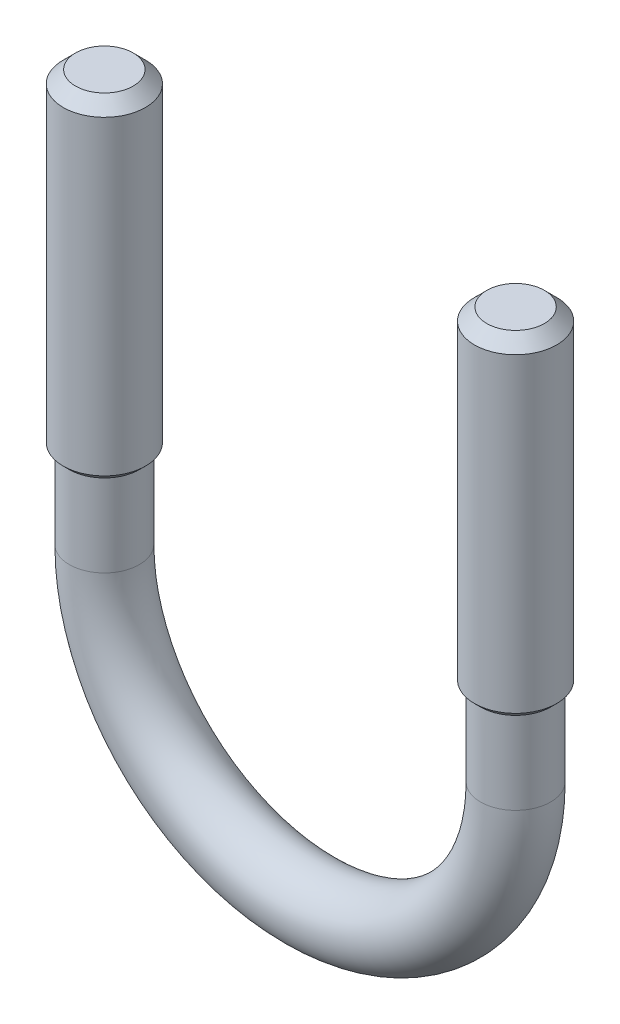
from build123d import *

# Parameters (mm, degrees)
SKETCH2_R           = 3.175
BOSS_EXTRUDE1_DEPTH = 25.4
CHAMFER2_SIZE       = 0.9525
CHAMFER3_SIZE       = 0.4699
SKETCH12_R          = 2.7051
SKETCH9_R           = 3.175
BOSS_EXTRUDE2_DEPTH = 2.778125
SKETCH10_OUTSIDE_W  = 233.937
SKETCH10_OUTSIDE_H  = 203.708
SKETCH10_OUTSIDE_R  = 5.55625
CUT_EXTRUDE1_DEPTH  = 51.205782884
CUT_EXTRUDE1_DRAFT  = -60
SKETCH11_OUTSIDE_W  = 217.071
SKETCH11_OUTSIDE_H  = 186.842
SKETCH11_OUTSIDE_R  = 5.55625
CUT_EXTRUDE2_DEPTH  = 46.336665415
CUT_EXTRUDE2_DRAFT  = -60
CHAMFER4_SIZE       = 0.381
LPATTERN1_COUNT     = 2
LPATTERN1_PITCH     = 31.75


with BuildPart() as part:
    # Sketch2 → Boss-Extrude1 (new body)
    with BuildSketch(Plane(origin=(0, 31.75, 0), x_dir=(-1, 0, 0), z_dir=(0, 1, 0))):
        with Locations(Location((15.875, 0, 0), (0, 0, 90))):
            Circle(SKETCH2_R)
    extrude(amount=-BOSS_EXTRUDE1_DEPTH)

    # Chamfer2
    chamfer2_edges = [part.edges().sort_by_distance(p)[0] for p in [
        (-15.875, 31.75, -3.175),
    ]]
    chamfer(chamfer2_edges, length=CHAMFER2_SIZE)

    # Chamfer3
    chamfer3_edges = [part.edges().sort_by_distance(p)[0] for p in [
        (-15.875, 6.35, -3.175),
    ]]
    chamfer(chamfer3_edges, length=CHAMFER3_SIZE)


with BuildPart() as body_2:
    # Mirror2: mirrored copy
    add(part.part.mirror(Plane(origin=(0, 0, 0), x_dir=(0, 0, 1), z_dir=(1, 0, 0))))


with BuildPart() as part_1:
    add(part.part)

    add(body_2.part)  # Sweep1 merges body 2
    # Sweep1: sweep along a path in Sketch8
    with BuildLine(Plane.XY) as sweep1_path:
        Line((-15.875, 19.05), (-15.875, 0))
        ThreePointArc((-15.875, 0), (0, -15.875), (15.875, 0))
        Line((15.875, 0), (15.875, 19.05))
    # Sketch12 → Sweep1 (sweep)
    with BuildSketch(Plane(origin=(0, 0, 0), x_dir=(0, 0, -1), z_dir=(1, 0, 0))):
        with Locations((0, -15.875)):
            Circle(SKETCH12_R)
    sweep(path=sweep1_path.line)


with BuildPart() as body_2_2:
    # Sketch9 → Boss-Extrude2 (new, symmetric)
    with BuildSketch(Plane(origin=(0, 23.283333333, 0), x_dir=(-1, 0, 0), z_dir=(0, 1, 0))):
        Polygon((-19.082902433, 5.55625), (-22.290804866, 0), (-19.082902433, -5.55625), (-12.667097567, -5.55625), (-9.459195134, 0), (-12.667097567, 5.55625), align=None)
        with Locations(Location((-15.875, 0, 0), (0, 0, 90))):
            Circle(SKETCH9_R, mode=Mode.SUBTRACT)
    extrude(amount=BOSS_EXTRUDE2_DEPTH, both=True)


with BuildPart() as cut_extrude1_tool:
    # Sketch10 outside → Cut-Extrude1 (with draft: the straight prism first)
    with BuildSketch(Plane(origin=(0, 26.061458333, 0), x_dir=(1, 0, 0), z_dir=(0, 1, 0))):
        with Locations((1.6205, 0)):
            Rectangle(SKETCH10_OUTSIDE_W, SKETCH10_OUTSIDE_H)
        with Locations((15.875, 0)):
            Circle(SKETCH10_OUTSIDE_R, mode=Mode.SUBTRACT)
    extrude(amount=-CUT_EXTRUDE1_DEPTH)
    # Cut-Extrude1: the draft: its side faces are tilted about the plane it starts from
    cut_extrude1_sides = [cut_extrude1_tool.faces().sort_by_distance(p)[0] for p in [
        (1.6205, 0.458566891, 101.854),
        (118.589, 0.458566891, 0),
        (1.6205, 0.458566891, -101.854),
        (-115.348, 0.458566891, 0),
        (10.31875, 0.458566891, 0),
    ]]
    draft(cut_extrude1_sides, Plane(origin=(0, 26.061458333, 0), x_dir=(1, 0, 0), z_dir=(0, 1, 0)), CUT_EXTRUDE1_DRAFT)


with BuildPart() as body_2_2_1:
    add(body_2_2.part)

    # Cut-Extrude1: cut by cut_extrude1_tool
    add(cut_extrude1_tool.part, mode=Mode.SUBTRACT)


with BuildPart() as cut_extrude2_tool:
    # Sketch11 outside → Cut-Extrude2 (with draft: the straight prism first)
    with BuildSketch(Plane.XZ.offset(-20.505208333)):
        with Locations((1.6205, 0)):
            Rectangle(SKETCH11_OUTSIDE_W, SKETCH11_OUTSIDE_H)
        with Locations((15.875, 0)):
            Circle(SKETCH11_OUTSIDE_R, mode=Mode.SUBTRACT)
    extrude(amount=-CUT_EXTRUDE2_DEPTH)
    # Cut-Extrude2: the draft: its side faces are tilted about the plane it starts from
    cut_extrude2_sides = [cut_extrude2_tool.faces().sort_by_distance(p)[0] for p in [
        (1.6205, 43.673541041, -93.421),
        (110.156, 43.673541041, 0),
        (1.6205, 43.673541041, 93.421),
        (-106.915, 43.673541041, 0),
        (10.31875, 43.673541041, 0),
    ]]
    draft(cut_extrude2_sides, Plane.XZ.offset(-20.505208333), CUT_EXTRUDE2_DRAFT)


with BuildPart() as body_2_2_2:
    add(body_2_2_1.part)

    # Cut-Extrude2: cut by cut_extrude2_tool
    add(cut_extrude2_tool.part, mode=Mode.SUBTRACT)

    # Chamfer4
    chamfer4_edges = [body_2_2_2.edges().sort_by_distance(p)[0] for p in [
        (15.875, 20.505208333, -3.175),
        (15.875, 26.061458333, -3.175),
    ]]
    chamfer(chamfer4_edges, length=CHAMFER4_SIZE)


with BuildPart() as lpattern1_1:
    # LPattern1: pattern copy
    add(body_2_2_2.part.moved(Location(Vector(-1, 0, 0) * (1 * LPATTERN1_PITCH))))


solid = part_1.part
